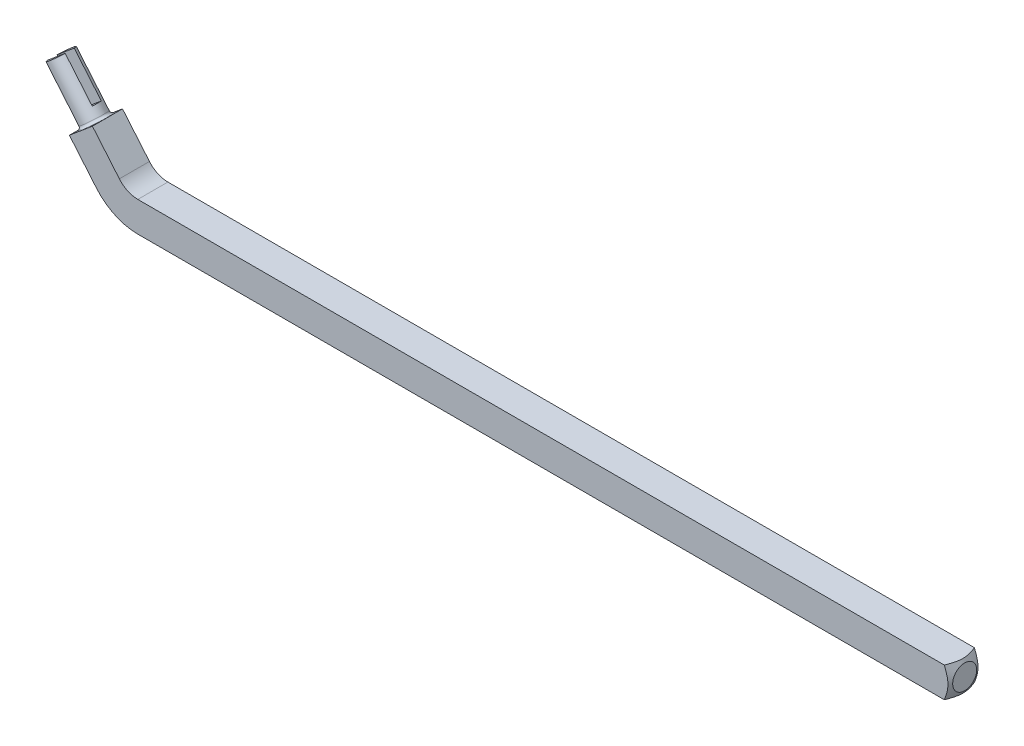
from build123d import *

# Parameters (mm, degrees)
EXTRUDE_1_DEPTH      = 2.5
EXTRUDE_1_DEPTH_BACK = 2.5
SKETCH_2_OUTSIDE_W   = 45.04
SKETCH_2_OUTSIDE_H   = 51.807
SKETCH_2_OUTSIDE_R   = 2
CUT_EXTRUDE_1_DEPTH  = 2.5
CUT_EXTRUDE_1_DRAFT  = -60
FILLET_2_R           = 4
FILLET_3_R           = 9
SKETCH_3_R           = 2
EXTRUDE_2_DEPTH      = 9
SKETCH_4_W           = 26.934408862
SKETCH_4_H           = 1.5
CUT_EXTRUDE_2_DEPTH  = 7
FILLET_4_R           = 0.5


with BuildPart() as part:
    # 草图1 → 凸台-拉伸1 (new, two sides: drawn at the far end of the back side and taken through both)
    with BuildSketch(Plane.XY.offset(-EXTRUDE_1_DEPTH_BACK)):
        Polygon((-1.165769145, -2.5), (-8.342987205, 6.053475407), (-4.512764989, 9.267413455), (1.165769145, 2.5), (138, 2.5), (138, -2.5), align=None)
    extrude(amount=EXTRUDE_1_DEPTH + EXTRUDE_1_DEPTH_BACK)


with BuildPart() as cut_extrude_1_tool:
    # 草图2 outside → 切除-拉伸1 (with draft: the straight prism first)
    with BuildSketch(Plane(origin=(138, 0, 0), x_dir=(0, 0, -1), z_dir=(1, 0, 0))):
        with Locations((0, 3.3835)):
            Rectangle(SKETCH_2_OUTSIDE_W, SKETCH_2_OUTSIDE_H)
        Circle(SKETCH_2_OUTSIDE_R, mode=Mode.SUBTRACT)
    extrude(amount=-CUT_EXTRUDE_1_DEPTH)
    # 切除-拉伸1: the draft: its side faces are tilted about the plane it starts from
    cut_extrude_1_sides = [cut_extrude_1_tool.faces().sort_by_distance(p)[0] for p in [
        (136.75, -22.52, 0),
        (136.75, 3.3835, -22.52),
        (136.75, 29.287, 0),
        (136.75, 3.3835, 22.52),
        (136.75, 0, 2),
    ]]
    draft(cut_extrude_1_sides, Plane(origin=(138, 0, 0), x_dir=(0, 0, -1), z_dir=(1, 0, 0)), CUT_EXTRUDE_1_DRAFT)


with BuildPart() as part_1:
    add(part.part)

    # 切除-拉伸1: cut by cut_extrude_1_tool
    add(cut_extrude_1_tool.part, mode=Mode.SUBTRACT)

    # 圆角2
    fillet_2_edges = [part_1.edges().sort_by_distance(p)[0] for p in [
        (1.165769145, 2.5, 0),
    ]]
    fillet(fillet_2_edges, radius=FILLET_2_R)

    # 圆角3
    fillet_3_edges = [part_1.edges().sort_by_distance(p)[0] for p in [
        (-1.165769145, -2.5, 0),
    ]]
    fillet(fillet_3_edges, radius=FILLET_3_R)

    # 草图3 → 凸台-拉伸2 (add)
    with BuildSketch(Plane(origin=(-6.427876097, 7.660444431, 0), x_dir=(0.7660444431189749, 0.6427876096865432, 0), z_dir=(-0.6427876096865431, 0.7660444431189748, 0))):
        Circle(SKETCH_3_R)
    extrude(amount=EXTRUDE_2_DEPTH)

    # 草图4 → 切除-拉伸2 (cut)
    with BuildSketch(Plane(origin=(-12.212964584, 14.554844419, 0), x_dir=(0.7660444431189747, 0.6427876096865435, 0), z_dir=(-0.6427876096865434, 0.7660444431189746, 0))):
        Rectangle(SKETCH_4_W, SKETCH_4_H)
    extrude(amount=-CUT_EXTRUDE_2_DEPTH, mode=Mode.SUBTRACT)

    # 圆角4
    fillet_4_edges = [part_1.edges().sort_by_distance(p)[0] for p in [
        (-7.959964983, 6.374869212, 0),
    ]]
    fillet(fillet_4_edges, radius=FILLET_4_R - 0.0001)  # a hair under: the kernel refuses the full size


solid = part_1.part
